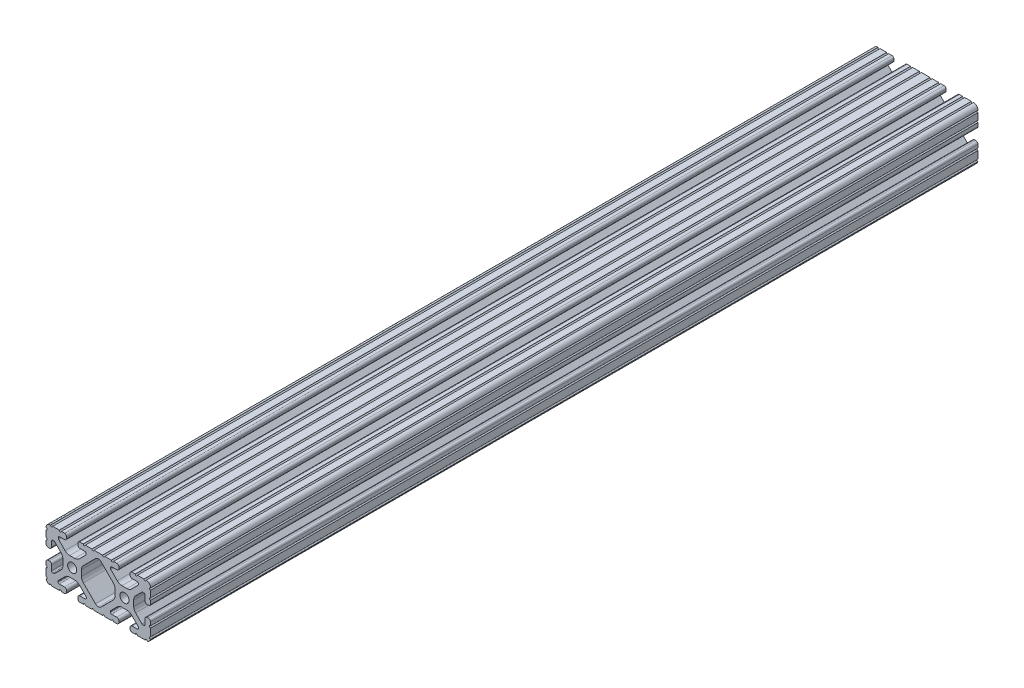
from build123d import *

# Parameters (mm, degrees)
SKETCH1_R      = 3.3274
EXTRUDE1_DEPTH = 603.25


with BuildPart() as part:
    # Sketch1 → Extrude1 (new body)
    with BuildSketch(Plane.XY):
        with BuildLine():
            Line((-3.121121376, -19.05), (3.121121376, -19.05))
            ThreePointArc((3.121121376, -19.05), (3.883121376, -18.288), (4.645121376, -19.05))
            Line((4.645121376, -19.05), (8.633115796, -19.05))
            Line((8.633115796, -19.05), (9.473536067, -19.05))
            ThreePointArc((9.473536067, -19.05), (10.235536067, -18.288), (10.997536067, -19.05))
            Line((10.997536067, -19.05), (13.4112, -19.05))
            ThreePointArc((13.4112, -19.05), (14.524751759, -18.588751759), (14.986, -17.4752))
            Line((14.986, -17.4752), (14.986, -16.5608))
            ThreePointArc((14.986, -16.5608), (14.524751759, -15.447248241), (13.4112, -14.986))
            Line((13.4112, -14.986), (9.652, -14.986))
            ThreePointArc((9.652, -14.986), (9.023382072, -14.725617928), (8.763, -14.097))
            Line((8.763, -14.097), (8.763, -13.687179678))
            ThreePointArc((8.763, -13.687179678), (8.830670671, -13.346975131), (9.023380503, -13.058563318))
            Line((9.023380503, -13.058563318), (13.852498595, -8.229421131))
            ThreePointArc((13.852498595, -8.229421131), (15.393447522, -7.199787805), (17.211122763, -6.838228541))
            Line((17.211122763, -6.838228541), (20.888877237, -6.838228541))
            ThreePointArc((20.888877237, -6.838228541), (22.706552478, -7.199787805), (24.247501405, -8.229421131))
            Line((24.247501405, -8.229421131), (29.076619497, -13.058563318))
            ThreePointArc((29.076619497, -13.058563318), (29.269329329, -13.346975131), (29.337, -13.687179678))
            Line((29.337, -13.687179678), (29.337, -14.097))
            ThreePointArc((29.337, -14.097), (29.076617928, -14.725617928), (28.448, -14.986))
            Line((28.448, -14.986), (24.6888, -14.986))
            ThreePointArc((24.6888, -14.986), (23.575248241, -15.447248241), (23.114, -16.5608))
            Line((23.114, -16.5608), (23.114, -17.4752))
            ThreePointArc((23.114, -17.4752), (23.575248241, -18.588751759), (24.6888, -19.05))
            Line((24.6888, -19.05), (26.945817469, -19.05))
            ThreePointArc((26.945817469, -19.05), (27.707817469, -18.288), (28.469817469, -19.05))
            Line((28.469817469, -19.05), (29.207115796, -19.05))
            Line((29.207115796, -19.05), (34.047273398, -19.05))
            ThreePointArc((34.047273398, -19.05), (34.809273398, -18.288), (35.571273398, -19.05))
            ThreePointArc((35.571273398, -19.05), (37.207577603, -18.182738167), (38.1, -16.560019212))
            ThreePointArc((38.1, -16.560019212), (37.338, -15.798019212), (38.1, -15.036019212))
            Line((38.1, -15.036019212), (38.1, -10.287))
            Line((38.1, -10.287), (38.1, -9.549701672))
            ThreePointArc((38.1, -9.549701672), (37.338, -8.787701672), (38.1, -8.025701672))
            Line((38.1, -8.025701672), (38.1, -5.6388))
            ThreePointArc((38.1, -5.6388), (37.638751759, -4.525248241), (36.5252, -4.064))
            Line((36.5252, -4.064), (35.6108, -4.064))
            ThreePointArc((35.6108, -4.064), (34.497248241, -4.525248241), (34.036, -5.6388))
            Line((34.036, -5.6388), (34.036, -9.398))
            ThreePointArc((34.036, -9.398), (33.775617928, -10.026617928), (33.147, -10.287))
            Line((33.147, -10.287), (32.420656743, -10.287))
            ThreePointArc((32.420656743, -10.287), (32.080450147, -10.21932848), (31.792037247, -10.02661636))
            Line((31.792037247, -10.02661636), (27.197575832, -5.43213202))
            ThreePointArc((27.197575832, -5.43213202), (26.167954729, -3.891188903), (25.8064, -2.07352461))
            Line((25.8064, -2.07352461), (25.8064, 2.07352461))
            ThreePointArc((25.8064, 2.07352461), (26.167954729, 3.891188903), (27.197575832, 5.43213202))
            Line((27.197575832, 5.43213202), (31.792037247, 10.02661636))
            ThreePointArc((31.792037247, 10.02661636), (32.080450147, 10.21932848), (32.420656743, 10.287))
            Line((32.420656743, 10.287), (33.147, 10.287))
            ThreePointArc((33.147, 10.287), (33.775617928, 10.026617928), (34.036, 9.398))
            Line((34.036, 9.398), (34.036, 5.6388))
            ThreePointArc((34.036, 5.6388), (34.497248241, 4.525248241), (35.6108, 4.064))
            Line((35.6108, 4.064), (36.5252, 4.064))
            ThreePointArc((36.5252, 4.064), (37.638751759, 4.525248241), (38.1, 5.6388))
            Line((38.1, 5.6388), (38.1, 8.025701672))
            ThreePointArc((38.1, 8.025701672), (37.338, 8.787701672), (38.1, 9.549701672))
            Line((38.1, 9.549701672), (38.1, 10.287))
            Line((38.1, 10.287), (38.1, 14.375206214))
            ThreePointArc((38.1, 14.375206214), (37.338232276, 15.156019383), (38.137614868, 15.89827725))
            ThreePointArc((38.137614868, 15.89827725), (37.148019028, 18.192014021), (34.819536496, 19.096833012))
            ThreePointArc((34.819536496, 19.096833012), (34.081312886, 18.311776389), (33.296256263, 19.05))
            Line((33.296256263, 19.05), (29.207115796, 19.05))
            Line((29.207115796, 19.05), (28.469817468, 19.05))
            ThreePointArc((28.469817468, 19.05), (27.707817468, 18.288), (26.945817468, 19.05))
            Line((26.945817468, 19.05), (24.558915796, 19.05))
            ThreePointArc((24.558915796, 19.05), (23.53023695, 18.547208069), (23.114, 17.480565346))
            Line((23.114, 17.480565346), (23.114, 16.5608))
            ThreePointArc((23.114, 16.5608), (23.575248241, 15.447248241), (24.6888, 14.986))
            Line((24.6888, 14.986), (28.295243665, 14.986))
            ThreePointArc((28.295243665, 14.986), (28.923861593, 14.725617928), (29.184243665, 14.097))
            Line((29.184243665, 14.097), (29.184243665, 13.53442258))
            ThreePointArc((29.184243665, 13.53442258), (29.116572993, 13.194218033), (28.923863161, 12.90580622))
            Line((28.923863161, 12.90580622), (24.247501405, 8.229421131))
            ThreePointArc((24.247501405, 8.229421131), (22.706552478, 7.199787805), (20.888877237, 6.838228541))
            Line((20.888877237, 6.838228541), (17.211122763, 6.838228541))
            ThreePointArc((17.211122763, 6.838228541), (15.393447522, 7.199787805), (13.852498595, 8.229421131))
            Line((13.852498595, 8.229421131), (9.176136839, 12.90580622))
            ThreePointArc((9.176136839, 12.90580622), (8.983427007, 13.194218033), (8.915756335, 13.53442258))
            Line((8.915756335, 13.53442258), (8.915756335, 14.097))
            ThreePointArc((8.915756335, 14.097), (9.176138407, 14.725617928), (9.804756335, 14.986))
            Line((9.804756335, 14.986), (13.4112, 14.986))
            ThreePointArc((13.4112, 14.986), (14.524751759, 15.447248241), (14.986, 16.5608))
            Line((14.986, 16.5608), (14.986, 17.496772581))
            ThreePointArc((14.986, 17.496772581), (14.531070222, 18.595070222), (13.432772581, 19.05))
            Line((13.432772581, 19.05), (10.997536067, 19.05))
            ThreePointArc((10.997536067, 19.05), (10.235536067, 18.288), (9.473536067, 19.05))
            Line((9.473536067, 19.05), (8.633115796, 19.05))
            Line((8.633115796, 19.05), (4.645121376, 19.05))
            ThreePointArc((4.645121376, 19.05), (3.883121376, 18.288), (3.121121376, 19.05))
            Line((3.121121376, 19.05), (-3.121121376, 19.05))
            ThreePointArc((-3.121121376, 19.05), (-3.883121376, 18.288), (-4.645121376, 19.05))
            Line((-4.645121376, 19.05), (-8.633115796, 19.05))
            Line((-8.633115796, 19.05), (-9.473536067, 19.05))
            ThreePointArc((-9.473536067, 19.05), (-10.235536067, 18.288), (-10.997536067, 19.05))
            Line((-10.997536067, 19.05), (-13.432772581, 19.05))
            ThreePointArc((-13.432772581, 19.05), (-14.531070222, 18.595070222), (-14.986, 17.496772581))
            Line((-14.986, 17.496772581), (-14.986, 16.5608))
            ThreePointArc((-14.986, 16.5608), (-14.524751759, 15.447248241), (-13.4112, 14.986))
            Line((-13.4112, 14.986), (-9.804756335, 14.986))
            ThreePointArc((-9.804756335, 14.986), (-9.176138407, 14.725617928), (-8.915756335, 14.097))
            Line((-8.915756335, 14.097), (-8.915756335, 13.53442258))
            ThreePointArc((-8.915756335, 13.53442258), (-8.983427007, 13.194218033), (-9.176136839, 12.90580622))
            Line((-9.176136839, 12.90580622), (-13.852498595, 8.229421131))
            ThreePointArc((-13.852498595, 8.229421131), (-15.393447522, 7.199787805), (-17.211122763, 6.838228541))
            Line((-17.211122763, 6.838228541), (-20.888877237, 6.838228541))
            ThreePointArc((-20.888877237, 6.838228541), (-22.706552478, 7.199787805), (-24.247501405, 8.229421131))
            Line((-24.247501405, 8.229421131), (-28.923863161, 12.90580622))
            ThreePointArc((-28.923863161, 12.90580622), (-29.116572993, 13.194218033), (-29.184243665, 13.53442258))
            Line((-29.184243665, 13.53442258), (-29.184243665, 14.097))
            ThreePointArc((-29.184243665, 14.097), (-28.923861593, 14.725617928), (-28.295243665, 14.986))
            Line((-28.295243665, 14.986), (-24.6888, 14.986))
            ThreePointArc((-24.6888, 14.986), (-23.575248241, 15.447248241), (-23.114, 16.5608))
            Line((-23.114, 16.5608), (-23.114, 17.480565346))
            ThreePointArc((-23.114, 17.480565346), (-23.53023695, 18.547208069), (-24.558915796, 19.05))
            Line((-24.558915796, 19.05), (-26.945817468, 19.05))
            ThreePointArc((-26.945817468, 19.05), (-27.707817468, 18.288), (-28.469817468, 19.05))
            Line((-28.469817468, 19.05), (-29.207115796, 19.05))
            Line((-29.207115796, 19.05), (-33.296256263, 19.05))
            ThreePointArc((-33.296256263, 19.05), (-34.081312886, 18.311776389), (-34.819536496, 19.096833012))
            ThreePointArc((-34.819536496, 19.096833012), (-37.148019028, 18.192014021), (-38.137614868, 15.89827725))
            ThreePointArc((-38.137614868, 15.89827725), (-37.338232276, 15.156019383), (-38.1, 14.375206214))
            Line((-38.1, 14.375206214), (-38.1, 10.287))
            Line((-38.1, 10.287), (-38.1, 9.549701672))
            ThreePointArc((-38.1, 9.549701672), (-37.338, 8.787701672), (-38.1, 8.025701672))
            Line((-38.1, 8.025701672), (-38.1, 5.6388))
            ThreePointArc((-38.1, 5.6388), (-37.638751759, 4.525248241), (-36.5252, 4.064))
            Line((-36.5252, 4.064), (-35.6108, 4.064))
            ThreePointArc((-35.6108, 4.064), (-34.497248241, 4.525248241), (-34.036, 5.6388))
            Line((-34.036, 5.6388), (-34.036, 9.398))
            ThreePointArc((-34.036, 9.398), (-33.775617928, 10.026617928), (-33.147, 10.287))
            Line((-33.147, 10.287), (-32.420656743, 10.287))
            ThreePointArc((-32.420656743, 10.287), (-32.080450147, 10.21932848), (-31.792037247, 10.02661636))
            Line((-31.792037247, 10.02661636), (-27.197575832, 5.43213202))
            ThreePointArc((-27.197575832, 5.43213202), (-26.167954729, 3.891188903), (-25.8064, 2.07352461))
            Line((-25.8064, 2.07352461), (-25.8064, -2.07352461))
            ThreePointArc((-25.8064, -2.07352461), (-26.167954729, -3.891188903), (-27.197575832, -5.43213202))
            Line((-27.197575832, -5.43213202), (-31.792037247, -10.02661636))
            ThreePointArc((-31.792037247, -10.02661636), (-32.080450147, -10.21932848), (-32.420656743, -10.287))
            Line((-32.420656743, -10.287), (-33.147, -10.287))
            ThreePointArc((-33.147, -10.287), (-33.775617928, -10.026617928), (-34.036, -9.398))
            Line((-34.036, -9.398), (-34.036, -5.6388))
            ThreePointArc((-34.036, -5.6388), (-34.497248241, -4.525248241), (-35.6108, -4.064))
            Line((-35.6108, -4.064), (-36.5252, -4.064))
            ThreePointArc((-36.5252, -4.064), (-37.638751759, -4.525248241), (-38.1, -5.6388))
            Line((-38.1, -5.6388), (-38.1, -8.025701672))
            ThreePointArc((-38.1, -8.025701672), (-37.338, -8.787701672), (-38.1, -9.549701672))
            Line((-38.1, -9.549701672), (-38.1, -10.287))
            Line((-38.1, -10.287), (-38.1, -15.036019212))
            ThreePointArc((-38.1, -15.036019212), (-37.338, -15.798019212), (-38.1, -16.560019212))
            ThreePointArc((-38.1, -16.560019212), (-37.20882252, -18.184002456), (-35.571273398, -19.05))
            ThreePointArc((-35.571273398, -19.05), (-34.809273398, -18.288), (-34.047273398, -19.05))
            Line((-34.047273398, -19.05), (-29.207115796, -19.05))
            Line((-29.207115796, -19.05), (-28.469817469, -19.05))
            ThreePointArc((-28.469817469, -19.05), (-27.707817469, -18.288), (-26.945817469, -19.05))
            Line((-26.945817469, -19.05), (-24.6888, -19.05))
            ThreePointArc((-24.6888, -19.05), (-23.575248241, -18.588751759), (-23.114, -17.4752))
            Line((-23.114, -17.4752), (-23.114, -16.5608))
            ThreePointArc((-23.114, -16.5608), (-23.575248241, -15.447248241), (-24.6888, -14.986))
            Line((-24.6888, -14.986), (-28.448, -14.986))
            ThreePointArc((-28.448, -14.986), (-29.076617928, -14.725617928), (-29.337, -14.097))
            Line((-29.337, -14.097), (-29.337, -13.687179678))
            ThreePointArc((-29.337, -13.687179678), (-29.269329329, -13.346975131), (-29.076619497, -13.058563318))
            Line((-29.076619497, -13.058563318), (-24.247501405, -8.229421131))
            ThreePointArc((-24.247501405, -8.229421131), (-22.706552478, -7.199787805), (-20.888877237, -6.838228541))
            Line((-20.888877237, -6.838228541), (-17.211122763, -6.838228541))
            ThreePointArc((-17.211122763, -6.838228541), (-15.393447522, -7.199787805), (-13.852498595, -8.229421131))
            Line((-13.852498595, -8.229421131), (-9.023380503, -13.058563318))
            ThreePointArc((-9.023380503, -13.058563318), (-8.830670671, -13.346975131), (-8.763, -13.687179678))
            Line((-8.763, -13.687179678), (-8.763, -14.097))
            ThreePointArc((-8.763, -14.097), (-9.023382072, -14.725617928), (-9.652, -14.986))
            Line((-9.652, -14.986), (-13.4112, -14.986))
            ThreePointArc((-13.4112, -14.986), (-14.524751759, -15.447248241), (-14.986, -16.5608))
            Line((-14.986, -16.5608), (-14.986, -17.4752))
            ThreePointArc((-14.986, -17.4752), (-14.524751759, -18.588751759), (-13.4112, -19.05))
            Line((-13.4112, -19.05), (-10.997536067, -19.05))
            ThreePointArc((-10.997536067, -19.05), (-10.235536067, -18.288), (-9.473536067, -19.05))
            Line((-9.473536067, -19.05), (-8.633115796, -19.05))
            Line((-8.633115796, -19.05), (-4.645121376, -19.05))
            ThreePointArc((-4.645121376, -19.05), (-3.883121376, -18.288), (-3.121121376, -19.05))
        make_face()
        with Locations((19.05, 0)):
            Circle(SKETCH1_R, mode=Mode.SUBTRACT)
        with Locations((-19.05, 0)):
            Circle(SKETCH1_R, mode=Mode.SUBTRACT)
        with BuildLine():
            Line((2.077035361, 14.257564863), (10.902424168, 5.43213202))
            ThreePointArc((10.902424168, 5.43213202), (11.932045271, 3.891188903), (12.2936, 2.07352461))
            Line((12.2936, 2.07352461), (12.2936, -2.07352461))
            ThreePointArc((12.2936, -2.07352461), (11.932045271, -3.891188903), (10.902424168, -5.43213202))
            Line((10.902424168, -5.43213202), (2.077035361, -14.257564863))
            ThreePointArc((2.077035361, -14.257564863), (1.124045601, -14.892973012), (0, -15.113096807))
            ThreePointArc((0, -15.113096807), (-1.124045601, -14.892973012), (-2.077035361, -14.257564863))
            Line((-2.077035361, -14.257564863), (-10.902424168, -5.43213202))
            ThreePointArc((-10.902424168, -5.43213202), (-11.932045271, -3.891188903), (-12.2936, -2.07352461))
            Line((-12.2936, -2.07352461), (-12.2936, 2.07352461))
            ThreePointArc((-12.2936, 2.07352461), (-11.932045271, 3.891188903), (-10.902424168, 5.43213202))
            Line((-10.902424168, 5.43213202), (-2.077035361, 14.257564863))
            ThreePointArc((-2.077035361, 14.257564863), (-1.124045601, 14.892973012), (0, 15.113096807))
            ThreePointArc((0, 15.113096807), (1.124045601, 14.892973012), (2.077035361, 14.257564863))
        make_face(mode=Mode.SUBTRACT)
    extrude(amount=-EXTRUDE1_DEPTH)


solid = part.part
